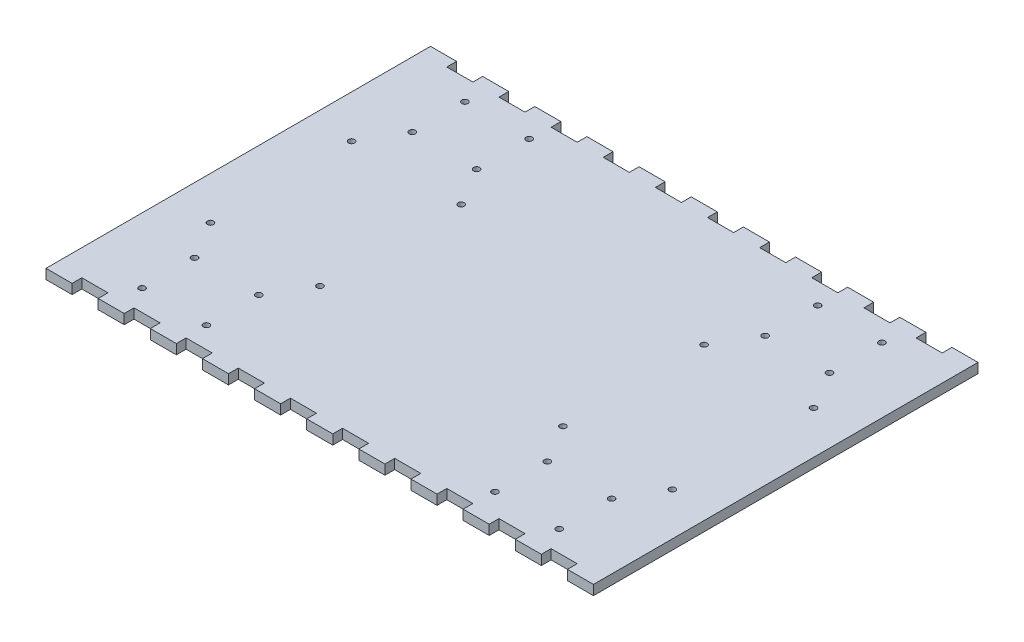
from build123d import *

# Parameters (mm, degrees)
BOSS_EXTRUDE1_DEPTH = 4.7625
SKETCH5_R           = 1.5
CUT_EXTRUDE1_DEPTH  = 283.708746438


with BuildPart() as part:
    # Sketch2 → Boss-Extrude1 (new body)
    with BuildSketch(Plane(origin=(0, 0, 0), x_dir=(1, 0, 0), z_dir=(0, 1, 0))):
        Polygon((25.4, 93.6625), (25.4, 88.9), (12.7, 88.9), (12.7, 93.6625), (0, 93.6625), (0, -93.6625), (12.7, -93.6625), (12.7, -88.9), (25.4, -88.9), (25.4, -93.6625), (38.1, -93.6625), (38.1, -88.9), (50.8, -88.9), (50.8, -93.6625), (63.5, -93.6625), (63.5, -88.9), (76.2, -88.9), (76.2, -93.6625), (88.9, -93.6625), (88.9, -88.9), (101.6, -88.9), (101.6, -93.6625), (114.3, -93.6625), (114.3, -88.9), (127, -88.9), (127, -93.6625), (139.7, -93.6625), (139.7, -88.9), (152.4, -88.9), (152.4, -93.6625), (165.1, -93.6625), (165.1, -88.9), (177.8, -88.9), (177.8, -93.6625), (190.5, -93.6625), (190.5, -88.9), (203.2, -88.9), (203.2, -93.6625), (215.9, -93.6625), (215.9, -88.9), (228.6, -88.9), (228.6, -93.6625), (241.3, -93.6625), (241.3, -88.9), (254, -88.9), (254, -93.6625), (266.7, -93.6625), (266.7, 93.6625), (254, 93.6625), (254, 88.9), (241.3, 88.9), (241.3, 93.6625), (228.6, 93.6625), (228.6, 88.9), (215.9, 88.9), (215.9, 93.6625), (203.2, 93.6625), (203.2, 88.9), (190.5, 88.9), (190.5, 93.6625), (177.8, 93.6625), (177.8, 88.9), (165.1, 88.9), (165.1, 93.6625), (152.4, 93.6625), (152.4, 88.9), (139.7, 88.9), (139.7, 93.6625), (127, 93.6625), (127, 88.9), (114.3, 88.9), (114.3, 93.6625), (101.6, 93.6625), (101.6, 88.9), (88.9, 88.9), (88.9, 93.6625), (76.2, 93.6625), (76.2, 88.9), (63.5, 88.9), (63.5, 93.6625), (50.8, 93.6625), (50.8, 88.9), (38.1, 88.9), (38.1, 93.6625), align=None)
    extrude(amount=BOSS_EXTRUDE1_DEPTH)

    # Sketch5 → Cut-Extrude1 (cut, through all)
    with BuildSketch(Plane(origin=(0, 4.7625, 0), x_dir=(1, 0, 0), z_dir=(0, 1, 0))):
        with Locations((31.75, 78.6125)):
            Circle(SKETCH5_R)
        with Locations((63.07, 78.6125)):
            Circle(SKETCH5_R)
        with Locations((63.07, 53.0625)):
            Circle(SKETCH5_R)
        with Locations((31.75, 53.0625)):
            Circle(SKETCH5_R)
        with Locations((203.63, 78.6125)):
            Circle(SKETCH5_R)
        with Locations((203.63, 53.0625)):
            Circle(SKETCH5_R)
        with Locations((234.95, 53.0625)):
            Circle(SKETCH5_R)
        with Locations((234.95, 78.6125)):
            Circle(SKETCH5_R)
        with Locations((234.95, -78.6125)):
            Circle(SKETCH5_R)
        with Locations((234.95, -53.0625)):
            Circle(SKETCH5_R)
        with Locations((203.63, -53.0625)):
            Circle(SKETCH5_R)
        with Locations((203.63, -78.6125)):
            Circle(SKETCH5_R)
        with Locations((31.75, -53.0625)):
            Circle(SKETCH5_R)
        with Locations((63.07, -53.0625)):
            Circle(SKETCH5_R)
        with Locations((63.07, -78.6125)):
            Circle(SKETCH5_R)
        with Locations((31.75, -78.6125)):
            Circle(SKETCH5_R)
        with Locations((20.83, 34.385)):
            Circle(SKETCH5_R)
        with Locations((74.17, 34.385)):
            Circle(SKETCH5_R)
        with Locations((192.53, 34.385)):
            Circle(SKETCH5_R)
        with Locations((245.87, 34.385)):
            Circle(SKETCH5_R)
        with Locations((245.87, -34.385)):
            Circle(SKETCH5_R)
        with Locations((192.53, -34.385)):
            Circle(SKETCH5_R)
        with Locations((74.17, -34.385)):
            Circle(SKETCH5_R)
        with Locations((20.83, -34.385)):
            Circle(SKETCH5_R)
    extrude(amount=-CUT_EXTRUDE1_DEPTH, mode=Mode.SUBTRACT)


solid = part.part
